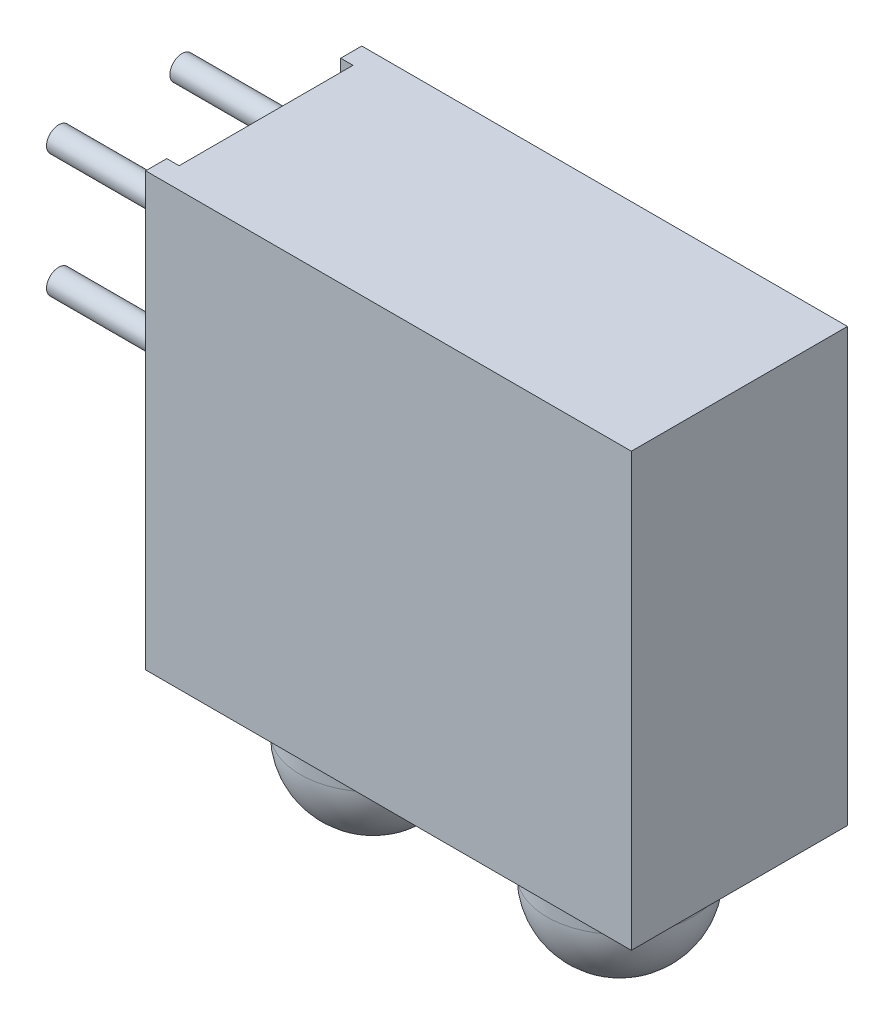
from build123d import *

# Parameters (mm, degrees)
SKETCH_1_W          = 10
SKETCH_1_H          = 4.45
EXTRUDE_1_DEPTH     = 8.9
SKETCH_2_R          = 1.5
EXTRUDE_2_DEPTH     = 1
CUT_EXTRUDE_1_REACH = 15.571
SKETCH_4_W          = 0.254
SKETCH_4_H          = 3.58
SKETCH_3_R          = 0.25
EXTRUDE_3_DEPTH     = 3


# Read off the part's stored shape, not the designer's step: 圆顶1, 圆顶2
with BuildPart() as part:
    # 草图1 → 凸台-拉伸1 (new body)
    with BuildSketch(Plane(origin=(0, 0, 0), x_dir=(1, 0, 0), z_dir=(0, 1, 0))):
        with Locations((5, 0)):
            Rectangle(SKETCH_1_W, SKETCH_1_H)
    extrude(amount=EXTRUDE_1_DEPTH)

    # 草图2 → 凸台-拉伸2 (add)
    with BuildSketch(Plane.XZ):
        with Locations(Location((7.54, 0, 0), (0, 0, 270))):
            Circle(SKETCH_2_R)
        with Locations(Location((2.46, 0, 0), (0, 0, 270))):
            Circle(SKETCH_2_R)
    extrude(amount=EXTRUDE_2_DEPTH)

    # 圆顶1 outline → 圆顶1 (revolve)
    with BuildSketch(Plane(origin=(7.54, 0, 0), x_dir=(1, 0, 0), z_dir=(0, 0, 1))):
        with BuildLine():
            Line((0, -0.999999998), (0, -2.5))
            ThreePointArc((0, -2.5), (1.060660172, -2.060660171), (1.5, -0.999999998))
            Line((1.5, -0.999999998), (0, -0.999999998))
        make_face()
    revolve(axis=Axis((7.54, 0, 0), (0, 1, 0)))

    # 圆顶2 outline → 圆顶2 (revolve)
    with BuildSketch(Plane(origin=(2.46, 0, 0), x_dir=(1, 0, 0), z_dir=(0, 0, 1))):
        with BuildLine():
            Line((0, -0.999999998), (0, -2.5))
            ThreePointArc((0, -2.5), (1.060660172, -2.060660171), (1.5, -0.999999998))
            Line((1.5, -0.999999998), (0, -0.999999998))
        make_face()
    revolve(axis=Axis((2.46, 0, 0), (0, 1, 0)))

    # 草图4 → 切除-拉伸1 (cut, up to next)
    with BuildSketch(Plane.XZ, mode=Mode.PRIVATE) as cut_extrude_1_sk1:
        with Locations((0.127, 0)):
            Rectangle(SKETCH_4_W, SKETCH_4_H)
    cut_extrude_1_tool1 = extrude(cut_extrude_1_sk1.sketch, amount=-CUT_EXTRUDE_1_REACH, mode=Mode.PRIVATE) & part.part
    add(cut_extrude_1_tool1.solids().sort_by_distance((0.127, 0, 0))[0], mode=Mode.SUBTRACT)

    # 草图3 → 凸台-拉伸3 (add)
    with BuildSketch(Plane.ZY.offset(-0.254)):
        with Locations(Location((-1.27, 5.08, 0), (0, 0, 180))):
            Circle(SKETCH_3_R)
        with Locations(Location((-1.27, 7.62, 0), (0, 0, 180))):
            Circle(SKETCH_3_R)
        with Locations(Location((1.27, 7.62, 0), (0, 0, 180))):
            Circle(SKETCH_3_R)
        with Locations(Location((1.27, 5.08, 0), (0, 0, 180))):
            Circle(SKETCH_3_R)
    extrude(amount=EXTRUDE_3_DEPTH)


solid = part.part
